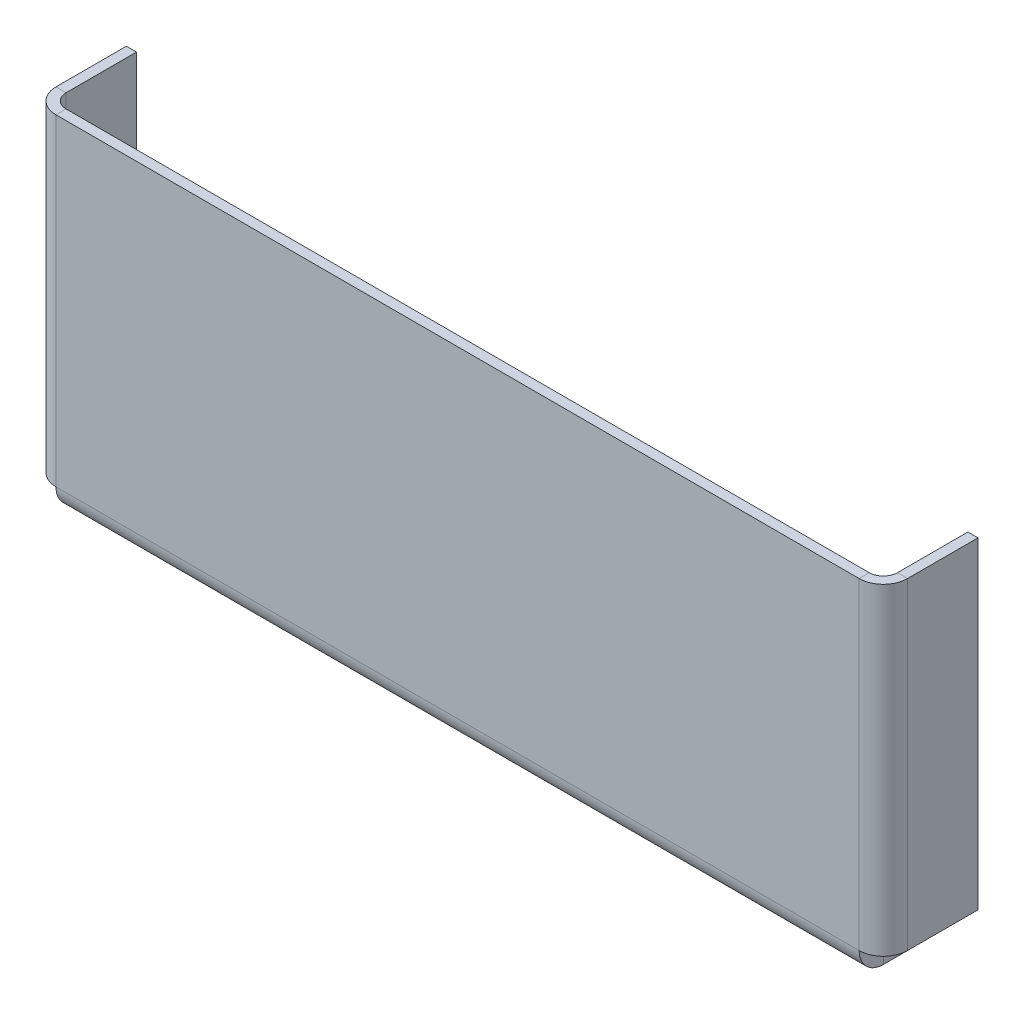
from build123d import *

# Parameters (mm, degrees)
BASE_FLANGE1_DEPTH     = 0.91186
SKETCHED_BEND1_DEPTH   = 72.39
SKETCHED_BEND1_2_DEPTH = 72.39
EDGE_FLANGE1_DEPTH     = 29.038915496
EDGE_FLANGE2_DEPTH     = 29.038915496


# Read off the part's stored shape, not the designer's step: Sketched Bend1
# Sheet-metal steps are written as plain solids
with BuildPart() as part:
    # Sketch1 → Base-Flange1 (new body)
    with BuildSketch(Plane(origin=(0, 0, 0), x_dir=(1, 0, 0), z_dir=(0, 1, 0))):
        Polygon((0, 38.1), (22.86, 50.8), (49.53, 50.8), (72.39, 38.1), (72.39, 0), (0, 0), align=None)
    extrude(amount=-BASE_FLANGE1_DEPTH)

    # Sketched Bend1 outline → Sketched Bend1 (cut)
    with BuildSketch(Plane.YZ):
        with BuildLine():
            ThreePointArc((-0.91186, -31.75), (-0.670550858, -30.752615706), (0, -29.975848636))
            Line((0, -29.975848636), (0, 0))
            Line((0, 0), (-0.91186, 0))
            Line((-0.91186, 0), (-0.91186, -31.75))
        make_face()
    extrude(amount=SKETCHED_BEND1_DEPTH, mode=Mode.SUBTRACT)

    # Sketched Bend1 2 outline → Sketched Bend1 2 (add)
    with BuildSketch(Plane.YZ):
        with BuildLine():
            Line((30.308915496, -30.48), (30.308915496, -29.56814))
            Line((30.308915496, -29.56814), (1.27, -29.56814))
            ThreePointArc((1.27, -29.56814), (0.603080527, -29.672566131), (0, -29.975848636))
            Line((0, -29.975848636), (0, -31.75))
            ThreePointArc((0, -31.75), (0.371974388, -30.851974388), (1.27, -30.48))
            Line((1.27, -30.48), (30.308915496, -30.48))
        make_face()
    extrude(amount=SKETCHED_BEND1_2_DEPTH)

    # Edge-Flange1 section (across the edge) → Edge-Flange1 (add)
    with BuildSketch(Plane(origin=(-1.27, 1.27, -30.48), x_dir=(1, 0, 0), z_dir=(0, 1, 0))):
        with BuildLine():
            Line((-0.91186, 1.27), (-0.91186, 7.62))
            Line((-0.91186, 7.62), (0, 7.62))
            Line((0, 7.62), (0, 1.27))
            ThreePointArc((0, 1.27), (0.371974388, 0.371974388), (1.27, 0))
            Line((1.27, 0), (1.27, -0.91186))
            ThreePointArc((1.27, -0.91186), (-0.272808002, -0.272808002), (-0.91186, 1.27))
        make_face()
    extrude(amount=EDGE_FLANGE1_DEPTH)

    # Edge-Flange2 section (across the edge) → Edge-Flange2 (add)
    with BuildSketch(Plane(origin=(73.66, 30.308915496, -30.48), x_dir=(-1, 0, 0), z_dir=(0, -1, 0))):
        with BuildLine():
            Line((-0.91186, 1.27), (-0.91186, 7.62))
            Line((-0.91186, 7.62), (0, 7.62))
            Line((0, 7.62), (0, 1.27))
            ThreePointArc((0, 1.27), (0.371974388, 0.371974388), (1.27, 0))
            Line((1.27, 0), (1.27, -0.91186))
            ThreePointArc((1.27, -0.91186), (-0.272808002, -0.272808002), (-0.91186, 1.27))
        make_face()
    extrude(amount=EDGE_FLANGE2_DEPTH)


solid = part.part
